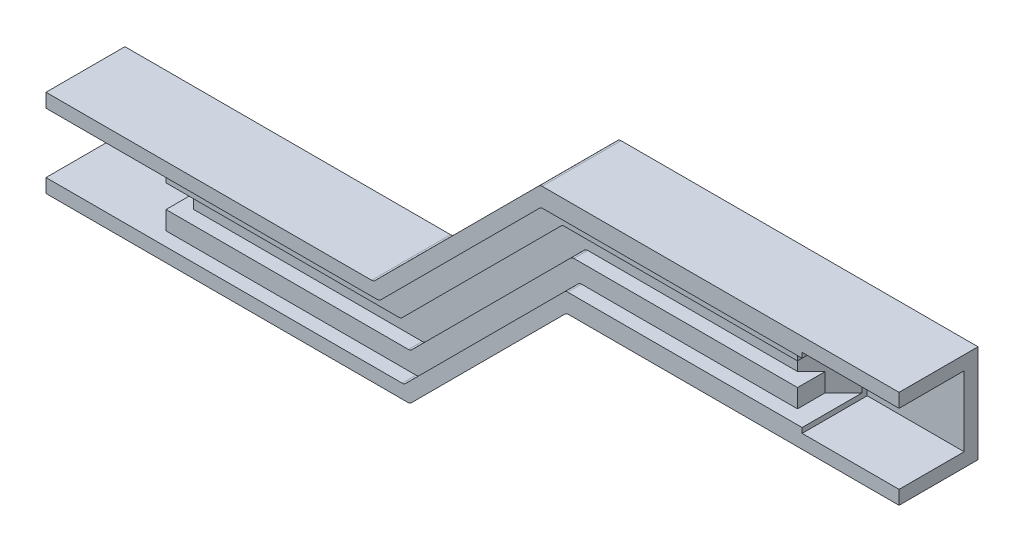
from build123d import *

# Parameters (mm, degrees)
SKETCH_10_R         = 1.65
EXTRUDE_1_DEPTH     = 3
EXTRUDE_START       = 3
EXTRUDE_2_DEPTH     = 7
EXTRUDE_3_DEPTH     = 13
CHAMFER_1_SIZE      = 7
EXTRUDE_5_DEPTH     = 10
EXTRUDE_START_2     = -1.1
SKETCH_16_R         = 1.65
EXTRUDE_6_DEPTH     = 4.1
EXTRUDE_7_DEPTH     = 16
SKETCH_18_W         = 21
SKETCH_18_H         = 15.2
CUT_EXTRUDE_1_DEPTH = 14.1
FILLET_1_R          = 1


with BuildPart() as part:
    # 草图10 → 凸台-拉伸1 (new body)
    with BuildSketch(Plane.XY):
        Polygon((-92.4, -8), (-21.435028843, -8), (13.564971157, 27), (92.4, 27), (92.4, 8), (21.435028843, 8), (-13.564971157, -27), (-92.4, -27), align=None)
        with Locations((-82.4, -17.5)):
            Circle(SKETCH_10_R, mode=Mode.SUBTRACT)
        with Locations((82.4, 17.5)):
            Circle(SKETCH_10_R, mode=Mode.SUBTRACT)
    extrude(amount=EXTRUDE_1_DEPTH)

    # 草图11 → 凸台-拉伸2 (add)
    with BuildSketch(Plane.XY.offset(EXTRUDE_START)):
        Polygon((-73.4, -8), (-73.4, -27), (-13.564971157, -27), (21.435028843, 8), (71.4, 8), (71.4, 27), (13.564971157, 27), (-21.435028843, -8), align=None)
    extrude(amount=EXTRUDE_2_DEPTH)

    # 草图12 → 凸台-拉伸3 (add)
    with BuildSketch(Plane.XY.offset(EXTRUDE_START)):
        Polygon((-92.4, -8), (-21.435028843, -8), (13.564971157, 27), (92.4, 27), (92.4, 24), (14.807611845, 24), (-20.192388155, -11), (-92.4, -11), align=None)
        Polygon((-92.4, -24), (-92.4, -27), (-13.564971157, -27), (21.435028843, 8), (92.4, 8), (92.4, 11), (20.192388155, 11), (-14.807611845, -24), align=None)
    extrude(amount=EXTRUDE_3_DEPTH)

    # 倒角1
    chamfer_1_edges = [part.edges().sort_by_distance(p)[0] for p in [
        (71.4, 17.5, 10),
        (-73.4, -17.5, 10),
    ]]
    chamfer(chamfer_1_edges, length=CHAMFER_1_SIZE - 0.0001)  # a hair under: the kernel refuses the full size

    # 草图15 → 凸台-拉伸5 (add)
    with BuildSketch(Plane.XY.offset(3)):
        Polygon((-69.4, -11), (-69.4, -15), (-18.535533906, -15), (16.464466094, 20), (67.4, 20), (67.4, 24), (14.807611845, 24), (-20.192388155, -11), align=None)
        Polygon((-69.4, -20), (-69.4, -24), (-14.807611845, -24), (20.192388155, 11), (67.4, 11), (67.4, 15), (18.535533906, 15), (-16.464466094, -20), align=None)
    extrude(amount=EXTRUDE_5_DEPTH)

    # 草图16 → 凸台-拉伸6 (add)
    with BuildSketch(Plane.XY.offset(EXTRUDE_START_2)):
        Polygon((-92.4, -8), (-92.4, -27), (-13.564971157, -27), (20.335028843, 6.9), (92.4, 6.9), (92.4, 28.1), (14.664971157, 28.1), (-21.435028843, -8), align=None)
        with Locations((-82.4, -17.5)):
            Circle(SKETCH_16_R, mode=Mode.SUBTRACT)
        with Locations((82.4, 17.5)):
            Circle(SKETCH_16_R, mode=Mode.SUBTRACT)
    extrude(amount=EXTRUDE_6_DEPTH)

    # 草图17 → 凸台-拉伸7 (add)
    with BuildSketch(Plane.XY):
        Polygon((92.4, 28.1), (92.4, 24), (14.807611845, 24), (12.686291501, 26.121320344), (14.664971157, 28.1), align=None)
        Polygon((92.4, 6.9), (20.335028843, 6.9), (18.213708499, 9.021320344), (20.192388155, 11), (92.4, 11), align=None)
    extrude(amount=EXTRUDE_7_DEPTH)

    # 草图18 → 切除-拉伸1 (cut)
    with BuildSketch(Plane.XY.offset(16)):
        with Locations((81.9, 17.5)):
            Rectangle(SKETCH_18_W, SKETCH_18_H)
    extrude(amount=-CUT_EXTRUDE_1_DEPTH, mode=Mode.SUBTRACT)


with BuildPart() as cut_extrude_1_kept_piece:
    # of the separate pieces the step leaves, the one the design keeps (cut_extrude_1_pieces_kept)
    add(part.part.solids().sort_by_distance((-73.4, -24, 3.0001))[0])

    # 圆角1
    fillet_1_edges = [cut_extrude_1_kept_piece.edges().sort_by_distance(p)[0] for p in [
        (-21.435028843, -8, 7.45),
        (-13.564971157, -27, 7.45),
        (-18.535533906, -15, 11.5),
        (16.464466094, 20, 11.5),
        (-16.464466094, -20, 11.5),
        (18.535533906, 15, 11.5),
        (20.335028843, 6.9, 7.45),
        (14.664971157, 28.1, 7.45),
        (14.807611845, 24, 14.5),
        (-20.192388155, -11, 14.5),
        (-14.807611845, -24, 14.5),
        (20.192388155, 11, 14.5),
    ]]
    fillet(fillet_1_edges, radius=FILLET_1_R)


solid = cut_extrude_1_kept_piece.part
